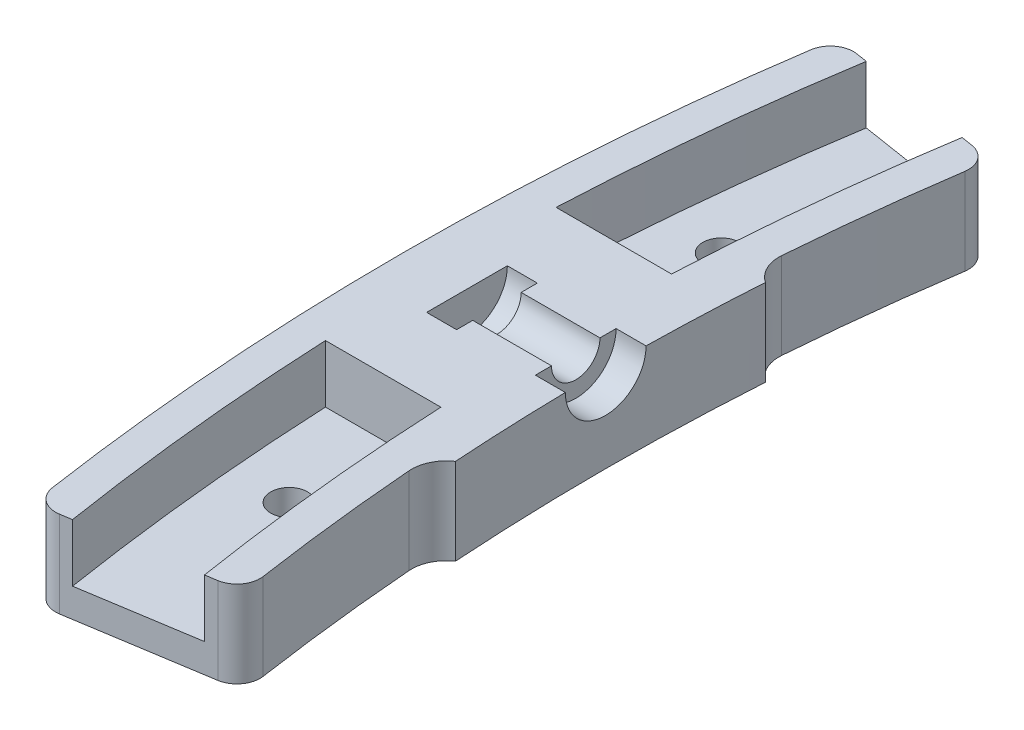
from build123d import *

# Parameters (mm, degrees)
BOSS_EXTRUDE1_DEPTH        = 10
CUT_EXTRUDE1_DEPTH         = 5
F_3_2_3_2_DIAMETER_HOLE1_D = 3.2
BOSS_EXTRUDE2_DEPTH        = 10
FILLET1_R                  = 3
FILLET2_R                  = 2
CUT_EXTRUDE6_DEPTH         = 2.5
SKETCH28_R                 = 3.5
CUT_EXTRUDE7_DEPTH         = 2.6
SKETCH29_W                 = 2.6
SKETCH29_H                 = 3.5
SKETCH30_R                 = 2.1
CUT_EXTRUDE8_DEPTH         = 6.829807515


with BuildPart() as part:
    # Sketch1 → Boss-Extrude1 (new body)
    with BuildSketch(Plane(origin=(0, 0, 0), x_dir=(1, 0, 0), z_dir=(0, 1, 0))):
        with BuildLine():
            ThreePointArc((-207.414551525, 32.851237658), (-210, 0), (-207.414551525, -32.851237658))
            Line((-207.414551525, -32.851237658), (-217.291434931, -34.415582309))
            ThreePointArc((-217.291434931, -34.415582309), (-220, 0), (-217.291434931, 34.415582309))
            Line((-217.291434931, 34.415582309), (-207.414551525, 32.851237658))
        make_face()
        with BuildLine():
            ThreePointArc((-217.291434931, -34.415582309), (-220, 0), (-217.291434931, 34.415582309))
            Line((-217.291434931, 34.415582309), (-220.254499953, 34.884885704))
            ThreePointArc((-220.254499953, 34.884885704), (-223, 0), (-220.254499953, -34.884885704))
            Line((-220.254499953, -34.884885704), (-217.291434931, -34.415582309))
        make_face()
        with BuildLine():
            Line((-204.451486503, 32.381934263), (-207.414551525, 32.851237658))
            ThreePointArc((-207.414551525, 32.851237658), (-210, 0), (-207.414551525, -32.851237658))
            Line((-207.414551525, -32.851237658), (-204.451486503, -32.381934263))
            ThreePointArc((-204.451486503, -32.381934263), (-207, 0), (-204.451486503, 32.381934263))
        make_face()
    extrude(amount=BOSS_EXTRUDE1_DEPTH)

    # Sketch15 → Cut-Extrude1 (cut)
    with BuildSketch(Plane(origin=(0, 10, 0), x_dir=(1, 0, 0), z_dir=(0, 1, 0))):
        with BuildLine():
            Line((-219.772609758, 10), (-209.761769634, 10))
            ThreePointArc((-209.761769634, 10), (-208.900850883, 21.457737542), (-207.414551525, 32.851237658))
            Line((-207.414551525, 32.851237658), (-217.291434931, 34.415582309))
            ThreePointArc((-217.291434931, 34.415582309), (-218.872736893, 22.242415451), (-219.772609758, 10))
        make_face()
        with BuildLine():
            ThreePointArc((-207.414551525, -32.851237658), (-208.900850883, -21.457737542), (-209.761769634, -10))
            Line((-209.761769634, -10), (-219.772609758, -10))
            ThreePointArc((-219.772609758, -10), (-218.872736893, -22.242415451), (-217.291434931, -34.415582309))
            Line((-217.291434931, -34.415582309), (-207.414551525, -32.851237658))
        make_face()
    extrude(amount=-CUT_EXTRUDE1_DEPTH, mode=Mode.SUBTRACT)

    # Ø3.2 (3.2) Diameter Hole1 (through all)
    with Locations(Plane(origin=(0, 0, 0), x_dir=(-1, 0, 0), z_dir=(0, -1, 0))):
        with Locations((214.18186009, -18.738484691), (214.18186009, 18.738484691)):
            Hole(F_3_2_3_2_DIAMETER_HOLE1_D / 2)

    # Sketch19 → Boss-Extrude2 (add)
    with BuildSketch(Plane(origin=(0, 0, 0), x_dir=(1, 0, 0), z_dir=(0, 1, 0))):
        with BuildLine():
            Line((-205.060008726, -13.440343057), (-206.55679711, -13.538447751))
            ThreePointArc((-206.55679711, -13.538447751), (-207, 0), (-206.55679711, 13.538447751))
            Line((-206.55679711, 13.538447751), (-205.060008726, 13.440343057))
            ThreePointArc((-205.060008726, 13.440343057), (-205.5, 0), (-205.060008726, -13.440343057))
        make_face()
    extrude(amount=BOSS_EXTRUDE2_DEPTH)

    # Fillet1
    # the kernel refuses this fillet: 3 mm, written as the material it adds along each edge
    with BuildSketch(Plane(origin=(-206.55679711, 0, -13.538447751), x_dir=(0.071732779716433, 0, -0.9974238859753429), z_dir=(0, 1, 0))) as fillet1_piece_1:
        with BuildLine():
            CenterArc((2.607610468, -2.999939619), FILLET1_R, 89.636481565, 60.364184224)
            Line((0.009516827, -1.49996981), (-0.042445046, -1.469970414))
            ThreePointArc((-0.042445046, -1.469970414), (-0.055240379, -0.750365578), (-0.059998792, -0.000380673))
            Line((-0.059998792, -0.000380673), (-0.000380673, 0.059998792))
            ThreePointArc((-0.000380673, 0.059998792), (1.313322061, 0.064166261), (2.627024794, 0.059998792))
            Line((2.627024794, 0.059998792), (2.626644121, 0))
        make_face()
    extrude(amount=10)
    with BuildSketch(Plane(origin=(-206.55679711, 0, 13.538447751), x_dir=(0.07173277971643319, 0, 0.9974238859753429), z_dir=(0, 1, 0))) as fillet1_piece_2:
        with BuildLine():
            CenterArc((2.607610468, 2.999939619), FILLET1_R, 209.999334211, 60.364184224)
            Line((0.009516827, 1.49996981), (-0.042445046, 1.469970414))
            ThreePointArc((-0.042445046, 1.469970414), (-0.055240379, 0.750365578), (-0.059998792, 0.000380673))
            Line((-0.059998792, 0.000380673), (-0.000380673, -0.059998792))
            ThreePointArc((-0.000380673, -0.059998792), (1.313322061, -0.064166261), (2.627024794, -0.059998792))
            Line((2.627024794, -0.059998792), (2.626644121, 0))
        make_face()
    extrude(amount=10)

    # Fillet2
    fillet2_edges = [part.edges().sort_by_distance(p)[0] for p in [
        (-220.254499953, 5, 34.884885704),
        (-220.254499953, 5, -34.884885704),
        (-204.451486503, 5, -32.381934263),
        (-204.451486503, 5, 32.381934263),
    ]]
    fillet(fillet2_edges, radius=FILLET2_R)

    # Sketch26 → Cut-Extrude6 (cut)
    with BuildSketch(Plane.XZ):
        with BuildLine():
            Line((-218.270184732, -34.570601048), (-206.417411405, -32.693306179))
            ThreePointArc((-206.417411405, -32.693306179), (-205.117889671, -31.901228423), (-204.75200014, -30.423978019))
            ThreePointArc((-204.75200014, -30.423978019), (-205.683905744, -23.30516934), (-206.368380626, -16.158325337))
            ThreePointArc((-206.368380626, -16.158325337), (-206.080650798, -14.622930952), (-205.060008726, -13.440343057))
            ThreePointArc((-205.060008726, -13.440343057), (-205.5, 0), (-205.060008726, 13.440343057))
            ThreePointArc((-205.060008726, 13.440343057), (-206.080650798, 14.622930952), (-206.368380626, 16.158325337))
            ThreePointArc((-206.368380626, 16.158325337), (-205.683905744, 23.30516934), (-204.75200014, 30.423978019))
            ThreePointArc((-204.75200014, 30.423978019), (-205.117889671, 31.901228423), (-206.417411405, 32.693306179))
            Line((-206.417411405, 32.693306179), (-218.270184732, 34.570601048))
            ThreePointArc((-218.270184732, 34.570601048), (-219.765933628, 34.207922413), (-220.561180845, 32.890203773))
            ThreePointArc((-220.561180845, 32.890203773), (-223, 0), (-220.561180845, -32.890203773))
            ThreePointArc((-220.561180845, -32.890203773), (-219.765933628, -34.207922413), (-218.270184732, -34.570601048))
        make_face()
    extrude(amount=-CUT_EXTRUDE6_DEPTH, mode=Mode.SUBTRACT)

    # Sketch28 → Cut-Extrude7 (cut)
    with BuildSketch(Plane(origin=(-217.5, 0, 0), x_dir=(0, 0, -1), z_dir=(1, 0, 0))):
        with Locations((0, 10)):
            Circle(SKETCH28_R)
    extrude(amount=CUT_EXTRUDE7_DEPTH, mode=Mode.SUBTRACT)

    # Sketch29 → Cut-Revolve1 (revolve, cut)
    with BuildSketch(Plane(origin=(0, 10, 0), x_dir=(1, 0, 0), z_dir=(0, 1, 0))):
        with Locations((-206.770192485, -1.75)):
            Rectangle(SKETCH29_W, SKETCH29_H)
    revolve(axis=Axis((-217.5, 10, 0), (1, 0, 0)), mode=Mode.SUBTRACT)

    # Sketch30 → Cut-Extrude8 (cut)
    with BuildSketch(Plane(origin=(-208.070192485, 0, 0), x_dir=(0, 0, -1), z_dir=(1, 0, 0))):
        with Locations((0, 10)):
            Circle(SKETCH30_R)
    extrude(amount=-CUT_EXTRUDE8_DEPTH, mode=Mode.SUBTRACT)


solid = part.part
